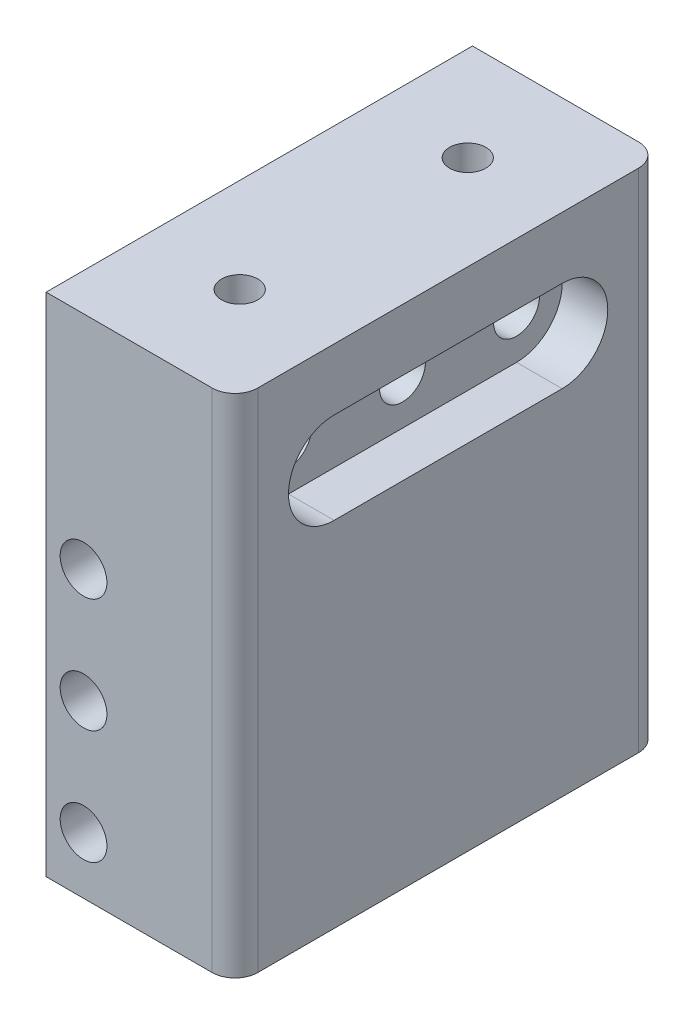
from build123d import *

# Parameters (mm, degrees)
SKETCH1_W           = 21.0312
SKETCH1_H           = 47.4853
BOSS_EXTRUDE1_DEPTH = 25.4
SKETCH2_R           = 2.6035
CUT_EXTRUDE1_DEPTH  = 55.868857829
SKETCH4_R           = 2.5527
CUT_EXTRUDE3_DEPTH  = 41.634773316
FILLET1_R           = 2.54
CUT_EXTRUDE5_DEPTH  = 5.08
BOSS_EXTRUDE2_START = 5.588
BOSS_EXTRUDE2_DEPTH = 5.588
SKETCH9_R           = 2.0193
CUT_EXTRUDE6_DEPTH  = 5.08


with BuildPart() as part:
    # Sketch1 → Boss-Extrude1 (new, symmetric)
    with BuildSketch(Plane(origin=(0, 0, 0), x_dir=(1, 0, 0), z_dir=(0, 1, 0))):
        Rectangle(SKETCH1_W, SKETCH1_H)
    extrude(amount=BOSS_EXTRUDE1_DEPTH, both=True)

    # Sketch2 → Cut-Extrude1 (cut, through all)
    with BuildSketch(Plane.XY.offset(23.74265)):
        with Locations((-6.35, -6.35)):
            Circle(SKETCH2_R)
        with Locations((-6.35, 6.35)):
            Circle(SKETCH2_R)
        with Locations((-6.35, -19.05)):
            Circle(SKETCH2_R)
    extrude(amount=-CUT_EXTRUDE1_DEPTH, mode=Mode.SUBTRACT)

    # Sketch4 → Cut-Extrude3 (cut, through all)
    with BuildSketch(Plane(origin=(10.5156, 0, 0), x_dir=(0, 0, -1), z_dir=(1, 0, 0))):
        with Locations((-12.7, 19.05)):
            Circle(SKETCH4_R)
        with Locations((12.7, 19.05)):
            Circle(SKETCH4_R)
        with Locations((0, 19.05)):
            Circle(SKETCH4_R)
    extrude(amount=-CUT_EXTRUDE3_DEPTH, mode=Mode.SUBTRACT)

    # Fillet1
    fillet1_edges = [part.edges().sort_by_distance(p)[0] for p in [
        (10.5156, 0, 23.74265),
        (10.5156, 0, -23.74265),
    ]]
    fillet(fillet1_edges, radius=FILLET1_R)

    # Sketch7 → Cut-Extrude5 (cut)
    with BuildSketch(Plane(origin=(10.5156, 0, 0), x_dir=(0, 0, -1), z_dir=(1, 0, 0))):
        with BuildLine():
            Line((-12.7, 24.13), (12.7, 24.13))
            ThreePointArc((12.7, 24.13), (17.78, 19.05), (12.7, 13.97))
            Line((12.7, 13.97), (-12.7, 13.97))
            ThreePointArc((-12.7, 13.97), (-17.78, 19.05), (-12.7, 24.13))
        make_face()
    extrude(amount=-CUT_EXTRUDE5_DEPTH, mode=Mode.SUBTRACT)

    # Sketch8 → Boss-Extrude2 (add)
    with BuildSketch(Plane(origin=(0, 25.4, 0), x_dir=(1, 0, 0), z_dir=(0, 1, 0)).offset(BOSS_EXTRUDE2_START)):
        with BuildLine():
            Line((-10.5156, -23.74265), (7.9756, -23.74265))
            ThreePointArc((7.9756, -23.74265), (9.771651224, -22.998701224), (10.5156, -21.20265))
            Line((10.5156, -21.20265), (10.5156, 21.20265))
            ThreePointArc((10.5156, 21.20265), (9.771651224, 22.998701224), (7.9756, 23.74265))
            Line((7.9756, 23.74265), (-10.5156, 23.74265))
            Line((-10.5156, 23.74265), (-10.5156, -23.74265))
        make_face()
    extrude(amount=-BOSS_EXTRUDE2_DEPTH)

    # Sketch9 → Cut-Extrude6 (cut)
    with BuildSketch(Plane(origin=(0, 30.988, 0), x_dir=(1, 0, 0), z_dir=(0, 1, 0))):
        with Locations((0, 12.7)):
            Circle(SKETCH9_R)
        with Locations((0, -12.7)):
            Circle(SKETCH9_R)
    extrude(amount=-CUT_EXTRUDE6_DEPTH, mode=Mode.SUBTRACT)


solid = part.part
